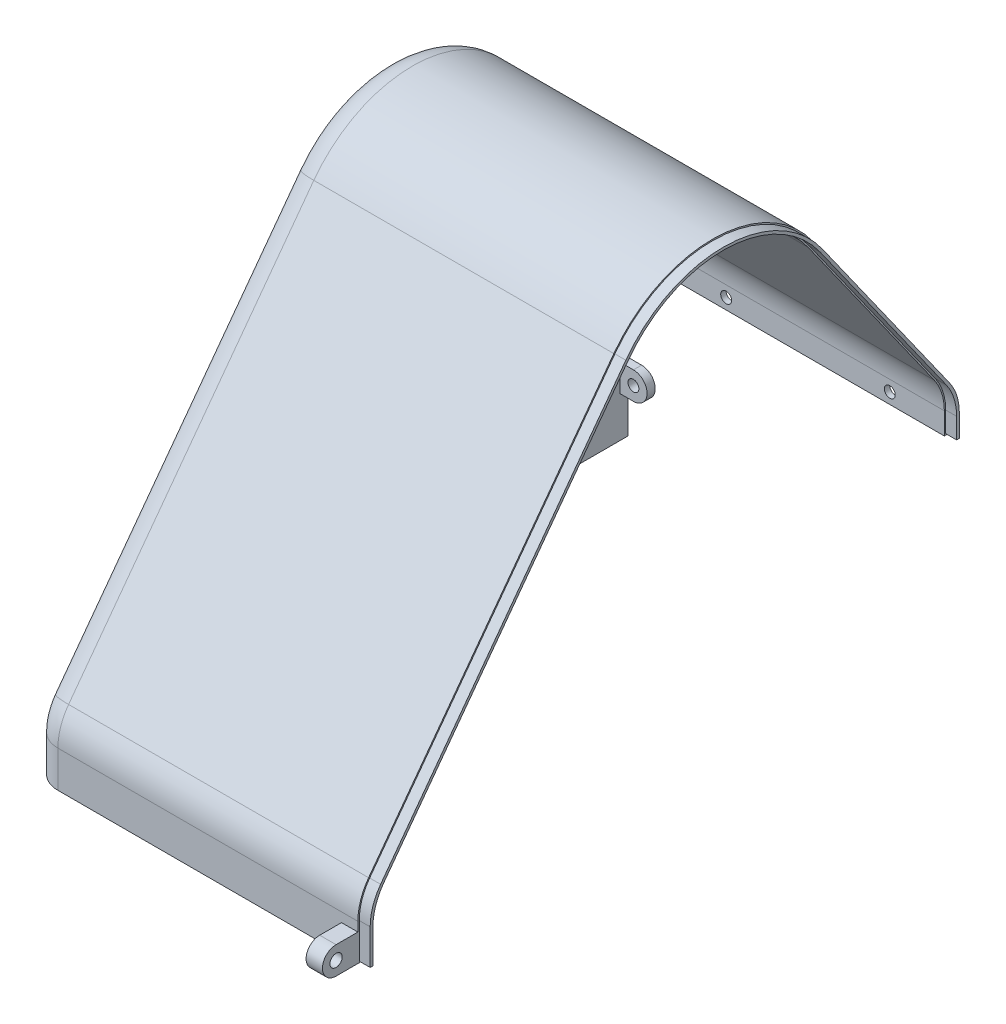
from build123d import *

# Parameters (mm, degrees)
CROQUIS1_R              = 12
SALIENTE_EXTRUIR1_DEPTH = 120
CORTAR_EXTRUIR1_DEPTH   = 118
REDONDEO1_R             = 20
CROQUIS3_W              = 250
CROQUIS3_H              = 250
CORTAR_EXTRUIR2_DEPTH   = 298.866030678
CROQUIS4_R              = 2
CORTAR_EXTRUIR3_DEPTH   = 20
CROQUIS5_R              = 2
SALIENTE_EXTRUIR2_DEPTH = 6
REDONDEO2_R             = 10
REDONDEO4_START         = 2.145107019
REDONDEO4_DEPTH         = 118.854892981
REDONDEO4_START_2       = 4.250447227
REDONDEO4_2_DEPTH       = 115.749552773
SALIENTE_EXTRUIR3_DEPTH = 4
CROQUIS7_R              = 2.25
SALIENTE_EXTRUIR4_DEPTH = 6
CROQUIS9_R              = 2.25
SALIENTE_EXTRUIR5_DEPTH = 6
CROQUIS10_R             = 2
SALIENTE_EXTRUIR6_DEPTH = 3
REDONDEO5_R             = 5


with BuildPart() as part:
    # Croquis1 → Saliente-Extruir1 (new body)
    with BuildSketch(Plane(origin=(0, 0, 0), x_dir=(0, 0, -1), z_dir=(1, 0, 0))):
        with BuildLine():
            Line((-200, 0), (200, 0))
            Line((200, 0), (200, 45))
            Line((200, 45), (175, 70))
            Line((175, 70), (17.023437057, 70))
            Line((17.023437057, 70), (17.023437057, 75))
            Line((17.023437057, 75), (-33.279638053, 146.01182459))
            ThreePointArc((-33.279638053, 146.01182459), (-69.531086216, 164.997556821), (-106.170314621, 146.771409007))
            Line((-106.170314621, 146.771409007), (-200, 20))
            Line((-200, 20), (-200, 0))
        make_face()
        with Locations((-70, 120)):
            Circle(CROQUIS1_R, mode=Mode.SUBTRACT)
    extrude(amount=SALIENTE_EXTRUIR1_DEPTH)

    # Croquis2 → Cortar-Extruir1 (cut)
    with BuildSketch(Plane(origin=(120, 0, 0), x_dir=(0, 0, -1), z_dir=(1, 0, 0))):
        with BuildLine():
            Line((35.023437057, 60), (35.023437057, 68))
            Line((35.023437057, 68), (174.171572875, 68))
            Line((174.171572875, 68), (198, 44.171572875))
            Line((198, 44.171572875), (198, 0))
            Line((198, 0), (-198, 0))
            Line((-198, 0), (-198, 19.340364538))
            Line((-198, 19.340364538), (-104.562745082, 145.581568607))
            ThreePointArc((-104.562745082, 145.581568607), (-69.551926829, 162.997665407), (-34.91165414, 144.855743497))
            Line((-34.91165414, 144.855743497), (15.023437057, 74.363394288))
            Line((15.023437057, 74.363394288), (15.023437057, 60))
            Line((15.023437057, 60), (35.023437057, 60))
        make_face()
    extrude(amount=-CORTAR_EXTRUIR1_DEPTH, mode=Mode.SUBTRACT)

    # Redondeo1
    redondeo1_edges = [part.edges().sort_by_distance(p)[0] for p in [
        (60, 20, 200),
        (60, 70, -175),
        (60, 45, -200),
        (61, 19.340364538, 198),
        (61, 68, -174.171572875),
        (61, 44.171572875, -198),
    ]]
    fillet(redondeo1_edges, radius=REDONDEO1_R)

    # Croquis3 → Cortar-Extruir2 (cut, through all)
    with BuildSketch(Plane(origin=(0, 0, -17.023437057), x_dir=(-1, 0, 0), z_dir=(0, 0, -1))):
        with Locations((-60, 64.142135624)):
            Rectangle(CROQUIS3_W, CROQUIS3_H)
    extrude(amount=CORTAR_EXTRUIR2_DEPTH, mode=Mode.SUBTRACT)

    # Croquis4 → Cortar-Extruir3 (cut)
    with BuildSketch(Plane(origin=(0, 0, -17.023437057), x_dir=(-1, 0, 0), z_dir=(0, 0, -1))):
        with Locations((-100, 64)):
            Circle(CROQUIS4_R)
        with Locations((-40, 64)):
            Circle(CROQUIS4_R)
    extrude(amount=-CORTAR_EXTRUIR3_DEPTH, mode=Mode.SUBTRACT)

    # Croquis5 → Saliente-Extruir2 (add)
    with BuildSketch(Plane(origin=(0, 0, -17.023437057), x_dir=(-1, 0, 0), z_dir=(0, 0, -1))):
        with Locations(Location((-70, 64, 0), (0, 0, 180))):
            Circle(CROQUIS5_R)
        with Locations(Location((-10, 64, 0), (0, 0, 180))):
            Circle(CROQUIS5_R)
    extrude(amount=SALIENTE_EXTRUIR2_DEPTH)

    # Redondeo2
    redondeo2_edges = [part.edges().sort_by_distance(p)[0] for p in [
        (0, 110.505912295, 8.128100498),
        (0, 6.701822688, 200),
        (0, 19.668072416, 198.993602972),
        (0, 86.036729193, 151.123005004),
        (0, 164.997556821, 69.531086216),
        (2, 6.372004957, 198),
        (2, 19.008436953, 196.993602972),
        (2, 109.609568893, 9.944108542),
        (2, 162.997665407, 69.551926829),
        (2, 85.111991262, 149.319220235),
    ]]
    fillet(redondeo2_edges, radius=REDONDEO2_R)

    # Redondeo4: read off the stored shape, not the designer's step
    # Redondeo4 outline → Redondeo4 (cut)
    with BuildSketch(Plane.YZ.offset(REDONDEO4_START)):
        with BuildLine():
            Line((75, -17.023437057), (80.194753812, -13.343597922))
            ThreePointArc((80.194753812, -13.343597922), (74.700110648, -16.081286061), (68.633942883, -17.023437057))
            Line((68.633942883, -17.023437057), (75, -17.023437057))
        make_face()
    extrude(amount=REDONDEO4_DEPTH, mode=Mode.SUBTRACT)

    # Redondeo4 2 outline → Redondeo4 2 (add)
    with BuildSketch(Plane.YZ.offset(REDONDEO4_START_2)):
        with BuildLine():
            Line((74.363394288, -15.023437057), (79.5581481, -11.343597922))
            ThreePointArc((79.5581481, -11.343597922), (74.063504936, -14.081286061), (67.997337171, -15.023437057))
            Line((67.997337171, -15.023437057), (74.363394288, -15.023437057))
        make_face()
    extrude(amount=REDONDEO4_2_DEPTH)

    # Croquis6 → Saliente-Extruir3 (add)
    with BuildSketch(Plane(origin=(120, 0, 0), x_dir=(0, 0, -1), z_dir=(1, 0, 0))):
        with BuildLine():
            Line((16.523437057, 60.5), (16.523437057, 68.633942883))
            ThreePointArc((16.523437057, 68.633942883), (15.604839835, 74.548456453), (12.9355939, 79.905733538))
            Line((12.9355939, 79.905733538), (-33.687642075, 145.722804317))
            ThreePointArc((-33.687642075, 145.722804317), (-69.536296369, 164.497583967), (-105.768422236, 146.473948907))
            Line((-105.768422236, 146.473948907), (-195.673803002, 25.00458928))
            ThreePointArc((-195.673803002, 25.00458928), (-198.518762898, 19.51146174), (-199.5, 13.403645376))
            Line((-199.5, 13.403645376), (-199.5, 0.5))
            Line((-199.5, 0.5), (-198.5, 0.5))
            Line((-198.5, 0.5), (-198.5, 12.744009914))
            ThreePointArc((-198.5, 12.744009914), (-197.468443047, 19.165047629), (-194.477587772, 24.939874017))
            Line((-194.477587772, 24.939874017), (-104.964637467, 145.879028707))
            ThreePointArc((-104.964637467, 145.879028707), (-69.546716676, 163.49763826), (-34.503650118, 145.144763771))
            Line((-34.503650118, 145.144763771), (11.751601944, 79.847168373))
            ThreePointArc((11.751601944, 79.847168373), (14.557732286, 74.21515913), (15.523437057, 67.997337171))
            Line((15.523437057, 67.997337171), (15.523437057, 60.5))
            Line((15.523437057, 60.5), (16.523437057, 60.5))
        make_face()
    extrude(amount=SALIENTE_EXTRUIR3_DEPTH)

    # Croquis7 → Saliente-Extruir4 (add)
    with BuildSketch(Plane.XZ):
        with BuildLine():
            Line((2, 75), (5, 75))
            ThreePointArc((5, 75), (10, 70), (5, 65))
            Line((5, 65), (2, 65))
            Line((2, 65), (2, 75))
        make_face()
        with Locations(Location((5, 70, 0), (0, 0, 270))):
            Circle(CROQUIS7_R, mode=Mode.SUBTRACT)
    extrude(amount=-SALIENTE_EXTRUIR4_DEPTH)

    # Croquis9 → Saliente-Extruir5 (add)
    with BuildSketch(Plane(origin=(120, 0, 0), x_dir=(0, 0, -1), z_dir=(1, 0, 0))):
        with BuildLine():
            Line((-200, 0), (-208, 0))
            ThreePointArc((-208, 0), (-213, 5), (-208, 10))
            Line((-208, 10), (-200, 10))
            Line((-200, 10), (-200, 0))
        make_face()
        with Locations((-208, 5)):
            Circle(CROQUIS9_R, mode=Mode.SUBTRACT)
    extrude(amount=-SALIENTE_EXTRUIR5_DEPTH)

    # Croquis10 → Saliente-Extruir6 (add)
    with BuildSketch(Plane(origin=(0, 0, -17.023437057), x_dir=(-1, 0, 0), z_dir=(0, 0, -1))):
        with BuildLine():
            Line((-2, 15), (-7, 15))
            ThreePointArc((-7, 15), (-12, 20), (-7, 25))
            Line((-7, 25), (-2, 25))
            Line((-2, 25), (-2, 15))
        make_face()
        with Locations((-7, 20)):
            Circle(CROQUIS10_R, mode=Mode.SUBTRACT)
    extrude(amount=-SALIENTE_EXTRUIR6_DEPTH)

    # Redondeo5
    # the kernel refuses this fillet: 5 mm, written as the material it takes off along each edge
    with BuildSketch(Plane(origin=(0, 120, 70), x_dir=(0, 0, -1), z_dir=(0, -1, 0))) as redondeo5_piece_1:
        with BuildLine():
            CenterArc((16, 5), REDONDEO5_R, 216.869897646, 53.130102354)
            Line((12, 2), (11.92, 1.94))
            ThreePointArc((11.92, 1.94), (11.9, 1), (11.9, 0))
            Line((11.9, 0), (12, -0.1))
            Line((12, -0.1), (16, -0.1))
            Line((16, -0.1), (16, 0))
        make_face()
    revolve(axis=Axis((0, 120, 70), (1, 0, 0)), mode=Mode.SUBTRACT)


solid = part.part
